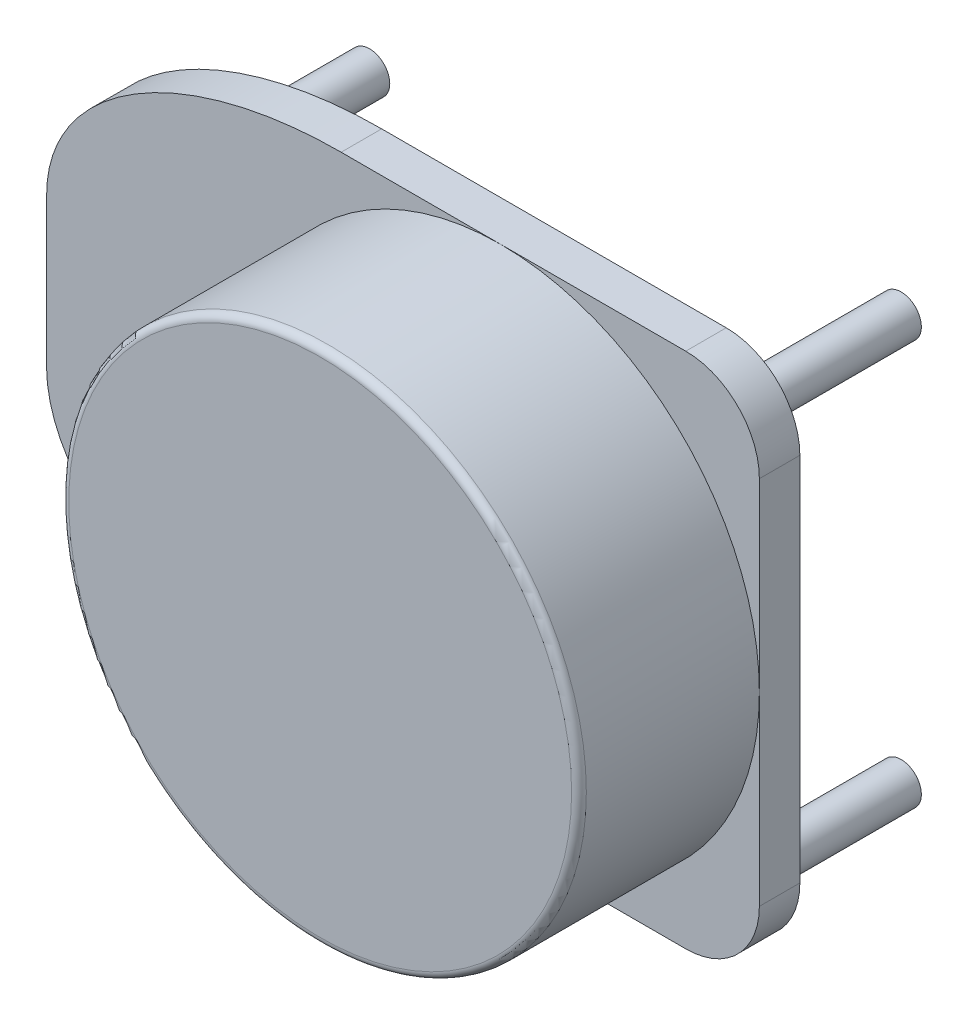
from build123d import *

# Parameters (mm, degrees)
EXTRUDE_1_DEPTH = 5.5
EXTRUDE_2_DEPTH = 24.5
FILLET_1_SIZE   = 25
FILLET_1_SIZE_2 = 40
EXTRUDE_3_DEPTH = 15.5
SKETCH_2_3_R    = 2.750000000000008
SKETCH_2_3_R_2  = 2.7499999999999982
SKETCH_2_3_R_3  = 2.7499999999999987
SKETCH_2_3_R_4  = 2.7500000000000084
EXTRUDE_4_DEPTH = 21


with BuildPart() as part:
    # 草图1 → 凸台-拉伸1 (new body)
    with BuildSketch(Plane.XY):
        with BuildLine():
            Line((-10.000000000000071, 0), (-96.8, 0))
            Line((-96.8, 0), (-96.8, 70.29999999999998))
            Line((-96.8, 70.29999999999998), (-10.000000000000071, 70.3))
            ThreePointArc((-10.000000000000071, 70.3), (-2.928932188134527, 67.37106781186547), (0, 60.29999999999993))
            Line((0, 60.29999999999993), (0, 10.000000000000071))
            ThreePointArc((0, 10.000000000000071), (-2.9289321881345236, 2.9289321881345245), (-10.000000000000071, 0))
        make_face()
    extrude(amount=-EXTRUDE_1_DEPTH)

    # 草图1<4> → 凸台-拉伸2 (add)
    with BuildSketch(Plane.XY):
        with BuildLine():
            ThreePointArc((-35.15, 70.29999999999998), (-70.3, 35.15), (-35.150000000000006, -7.11e-15))
            Line((-35.15, 0), (-35.15, 70.3))
        make_face()
        with BuildLine():
            Line((-35.15, 70.3), (-35.15, 0))
            ThreePointArc((-35.150000000000006, -7.11e-15), (-10.295196641292861, 10.29519664129284), (0, 35.149999999999984))
            ThreePointArc((0, 35.14999999999999), (-10.295196641292854, 60.004803358707136), (-35.15, 70.29999999999998))
        make_face()
    extrude(amount=EXTRUDE_2_DEPTH)

    # 圆角1
    # a fillet whose section is not a circle: 40, 25 mm, written as the material it takes off along each edge
    with BuildSketch(Plane(origin=(-96.8, 70.29999999999998, 100.00000000000001), x_dir=(0, -1, 0), z_dir=(0, 0, -1))) as fillet_1_piece_1:
        with BuildLine():
            Bezier((FILLET_1_SIZE, 0), (0, 0), (0, -FILLET_1_SIZE_2), weights=[1, 0.7071067811865476, 1])
            Line((0, -FILLET_1_SIZE_2), (0, 0))
            Line((0, 0), (FILLET_1_SIZE, 0))
        make_face()
    extrude(amount=205.50000000000003, mode=Mode.SUBTRACT)
    with BuildSketch(Plane(origin=(-96.8, 0, 100.00000000000001), x_dir=(1, 0, 0), z_dir=(0, 0, -1))) as fillet_1_piece_2:
        with BuildLine():
            Bezier((FILLET_1_SIZE_2, 0), (0, 0), (0, -FILLET_1_SIZE), weights=[1, 0.7071067811865476, 1])
            Line((0, -FILLET_1_SIZE), (0, 0))
            Line((0, 0), (FILLET_1_SIZE_2, 0))
        make_face()
    extrude(amount=205.50000000000003, mode=Mode.SUBTRACT)

    # 圆角2: read off the stored shape, not the designer's step
    # 圆角2 outline → 圆角2 (revolve, cut)
    with BuildSketch(Plane(origin=(-35.15, 35.15, 0), x_dir=(1, 0, 0), z_dir=(0, -1, 0))):
        with BuildLine():
            ThreePointArc((34.15, 24.5), (34.857106781, 24.207106781), (35.15, 23.5))
            Line((35.15, 23.5), (35.15, 24.5))
            Line((35.15, 24.5), (34.15, 24.5))
        make_face()
    revolve(axis=Axis((-35.15, 35.15, 0), (0, 0, 1)), mode=Mode.SUBTRACT)

    # 草图2 → 凸台-拉伸3 (add)
    with BuildSketch(Plane(origin=(0, 0, -5.5), x_dir=(-1, 0, 0), z_dir=(0, 0, -1))):
        with BuildLine():
            ThreePointArc((65, 35.14999999999999), (80.9, 19.249999999999993), (96.80000000000001, 35.149999999999984))
            Line((96.8, 35.15), (65, 35.149999999999984))
        make_face()
        with BuildLine():
            Line((65, 35.149999999999984), (96.8, 35.15))
            ThreePointArc((96.80000000000001, 35.14999999999999), (80.9, 51.04999999999999), (65, 35.14999999999999))
        make_face()
    extrude(amount=EXTRUDE_3_DEPTH)

    # 草图2<3> → 凸台-拉伸4 (add)
    with BuildSketch(Plane(origin=(0, 0, -5.5), x_dir=(-1, 0, 0), z_dir=(0, 0, -1))):
        with Locations(Location((79.45, 15.149999999999999, 0), (0, 0, 180))):
            Circle(SKETCH_2_3_R)
        with Locations(Location((7.250000000000006, 7.64999999999999, 0), (0, 0, 180))):
            Circle(SKETCH_2_3_R_2)
        with Locations(Location((7.249999999999993, 62.65, 0), (0, 0, 180))):
            Circle(SKETCH_2_3_R_3)
        with Locations(Location((79.44999999999999, 55.15, 0), (0, 0, 180))):
            Circle(SKETCH_2_3_R_4)
    extrude(amount=EXTRUDE_4_DEPTH)


solid = part.part
